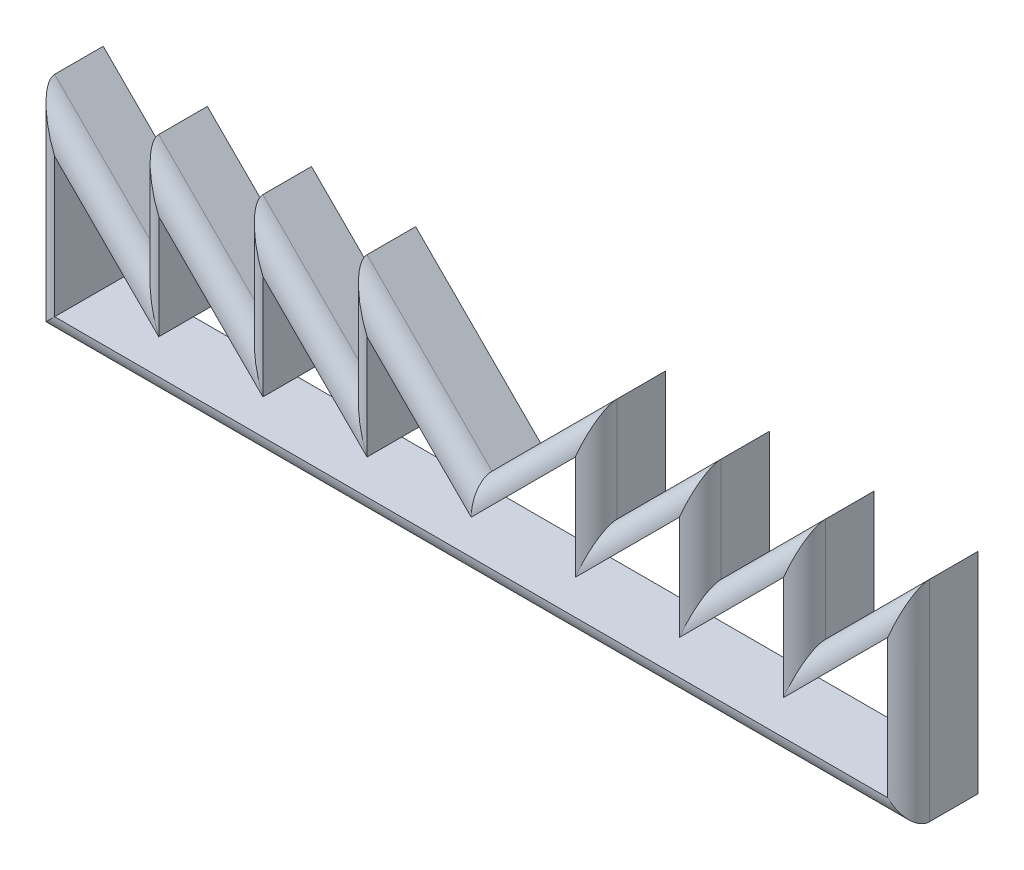
from build123d import *

# Parameters (mm, degrees)
BOSS_EXTRUDE1_DEPTH = 10
FILLET11_R          = 3


with BuildPart() as part:
    # Sketch2 → Boss-Extrude1 (new body)
    with BuildSketch(Plane.XY):
        Polygon((-60, 9.242640687), (-42, 27.242640687), (-42, 12.242640687), (-27, 27.242640687), (-27, 12.242640687), (-12, 27.242640687), (-12, 12.242640687), (3, 27.242640687), (3, -3), (-123, -3), (-123, 27.242640687), (-108, 12.242640687), (-108, 27.242640687), (-93, 12.242640687), (-93, 27.242640687), (-78, 12.242640687), (-78, 27.242640687), align=None)
        Polygon((-60, 5), (-45, 20), (-45, 5), (-30, 20), (-30, 5), (-15, 20), (-15, 5), (0, 20), (0, 0), (-120, 0), (-120, 20), (-105, 5), (-105, 20), (-90, 5), (-90, 20), (-75, 5), (-75, 20), align=None, mode=Mode.SUBTRACT)
    extrude(amount=BOSS_EXTRUDE1_DEPTH)

    # Fillet11
    fillet11_edges = [part.edges().sort_by_distance(p)[0] for p in [
        (-85.5, 19.742640687, 10),
        (-93, 19.742640687, 10),
        (-100.5, 19.742640687, 10),
        (-108, 19.742640687, 10),
        (-115.5, 19.742640687, 10),
        (-123, 12.121320344, 10),
        (-60, -3, 10),
        (3, 12.121320344, 10),
        (-4.5, 19.742640687, 10),
        (-12, 19.742640687, 10),
        (-69, 18.242640687, 10),
        (-19.5, 19.742640687, 10),
        (-27, 19.742640687, 10),
        (-34.5, 19.742640687, 10),
        (-42, 19.742640687, 10),
        (-51, 18.242640687, 10),
        (-78, 19.742640687, 10),
    ]]
    fillet(fillet11_edges, radius=FILLET11_R - 0.0001)  # a hair under: the kernel refuses the full size


solid = part.part
